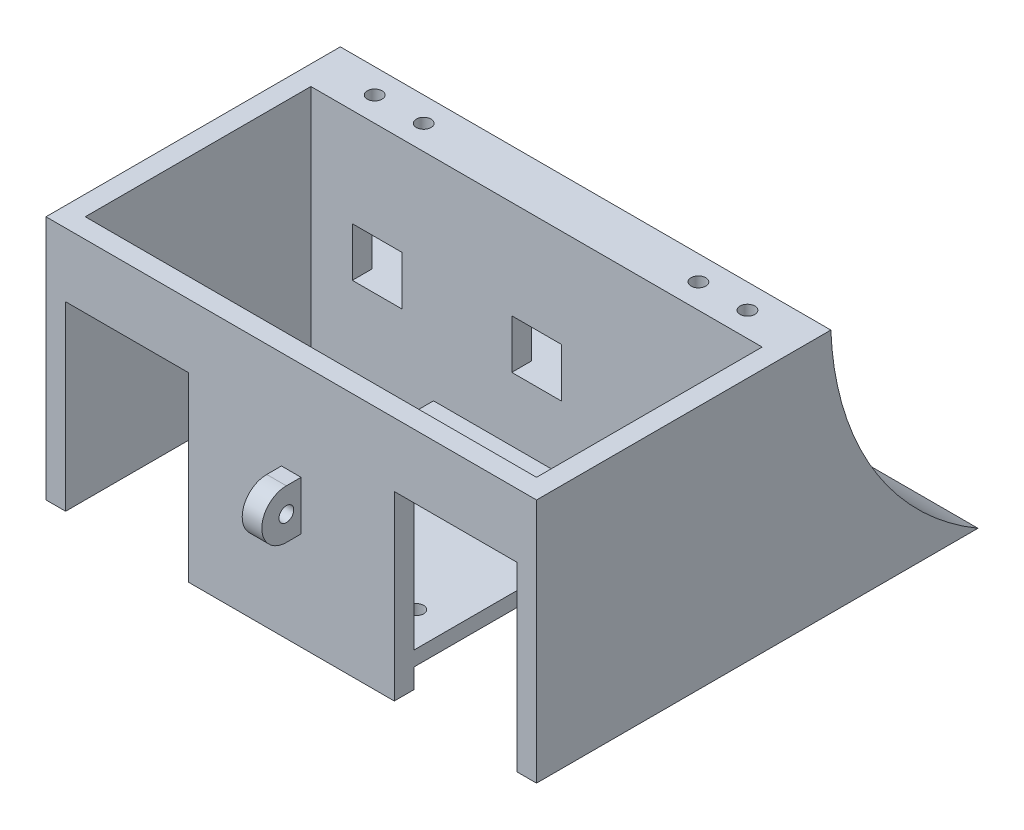
from build123d import *

# Parameters (mm, degrees)
CROQUIS1_W                          = 100
CROQUIS1_H                          = 60
SALIENTE_EXTRUIR1_DEPTH             = 50
VACIADO1_T                          = -4
SALIENTE_EXTRUIR2_REACH             = 78.811
SALIENTE_EXTRUIR2_DIRECTION_2_REACH = 78.811
CORTAR_EXTRUIR1_START               = -4
CROQUIS3_W                          = 44
CROQUIS3_H                          = 37
CORTAR_EXTRUIR1_DEPTH               = 25
CROQUIS5_W                          = 92
CROQUIS5_H                          = 46
SALIENTE_EXTRUIR3_DEPTH             = 6
CORTAR_EXTRUIR2_START               = 2
CROQUIS4_W                          = 10.1
CROQUIS4_H                          = 10
CORTAR_EXTRUIR2_DEPTH               = 16
CROQUIS4_3_W                        = 10.1
CROQUIS4_3_H                        = 10
CORTAR_EXTRUIR3_DEPTH               = 6
SALIENTE_EXTRUIR4_DEPTH             = 3
CORTAR_EXTRUIR4_DEPTH               = 4
CROQUIS7_R                          = 1.5
CROQUIS7_W                          = 25
CROQUIS7_H                          = 6
CORTAR_EXTRUIR5_DEPTH               = 3
CORTAR_EXTRUIR6_START               = -2
CORTAR_EXTRUIR6_DEPTH               = 2
CROQUIS9_R                          = 1.5
CORTAR_EXTRUIR7_DEPTH               = 5
MATRIZL2_COUNT                      = 2
MATRIZL2_PITCH                      = 32.5
MATRIZL2_COL_COUNT                  = 2
MATRIZL2_COL_PITCH                  = 32.5
SALIENTE_EXTRUIR5_DEPTH             = 2
SALIENTE_EXTRUIR5_DEPTH_BACK        = 2
CROQUIS10_R                         = 1.5


# Read off the part's stored shape, not the designer's step: Cortar-Extruir6
with BuildPart() as part:
    # Croquis1 → Saliente-Extruir1 (new body)
    with BuildSketch(Plane(origin=(0, 0, 0), x_dir=(1, 0, 0), z_dir=(0, 1, 0))):
        Rectangle(CROQUIS1_W, CROQUIS1_H)
    extrude(amount=SALIENTE_EXTRUIR1_DEPTH)

    # Vaciado1
    vaciado1_openings = [part.faces().sort_by_distance(p)[0] for p in [
        (0, 50, 0),
    ]]
    offset(amount=VACIADO1_T, openings=vaciado1_openings, kind=Kind.INTERSECTION)

    # Saliente-Extruir2: up to this face of the body (flat: up to its plane)
    saliente_extruir2_end = Plane(part.part.faces().sort_by_distance((50, 25, 0))[0])
    # Croquis2 → Saliente-Extruir2 (add, up to the picked face)
    with BuildSketch(Plane(origin=(0, 0, 0), x_dir=(0, 0, -1), z_dir=(1, 0, 0)), mode=Mode.PRIVATE) as saliente_extruir2_sk1:
        with BuildLine():
            Line((30, 50), (30, 0))
            Line((30, 0), (60, 0))
            ThreePointArc((60, 0), (38.605216469, 21.163129881), (30, 50))
        make_face()
    saliente_extruir2_tool1 = split(extrude(saliente_extruir2_sk1.sketch, amount=SALIENTE_EXTRUIR2_REACH, mode=Mode.PRIVATE), bisect_by=saliente_extruir2_end, keep=Keep.BOTH, mode=Mode.PRIVATE)
    add(saliente_extruir2_tool1.solids().sort_by(Axis((0, 12.297195, -38.437511), (1, 0, 0)))[0])

    # Saliente-Extruir2 direction 2: up to this face of the body (flat: up to its plane)
    saliente_extruir2_direction_2_end = Plane(part.part.faces().sort_by_distance((-50, 25, 0))[0])
    # Croquis2 → Saliente-Extruir2 direction 2 (add, up to the picked face)
    with BuildSketch(Plane(origin=(0, 0, 0), x_dir=(0, 0, -1), z_dir=(1, 0, 0)), mode=Mode.PRIVATE) as saliente_extruir2_direction_2_sk1:
        with BuildLine():
            Line((30, 50), (30, 0))
            Line((30, 0), (60, 0))
            ThreePointArc((60, 0), (38.605216469, 21.163129881), (30, 50))
        make_face()
    saliente_extruir2_direction_2_tool1 = split(extrude(saliente_extruir2_direction_2_sk1.sketch, amount=-SALIENTE_EXTRUIR2_DIRECTION_2_REACH, mode=Mode.PRIVATE), bisect_by=saliente_extruir2_direction_2_end, keep=Keep.BOTH, mode=Mode.PRIVATE)
    add(saliente_extruir2_direction_2_tool1.solids().sort_by(Axis((0, 12.297195, -38.437511), (-1, 0, 0)))[0])

    # Croquis3 → Cortar-Extruir1 (cut)
    with BuildSketch(Plane.ZY.offset(50).offset(CORTAR_EXTRUIR1_START)):
        with Locations((8, 18.5)):
            Rectangle(CROQUIS3_W, CROQUIS3_H)
    cortar_extruir1 = extrude(amount=-CORTAR_EXTRUIR1_DEPTH, mode=Mode.SUBTRACT)

    # Croquis5 → Saliente-Extruir3 (add)
    with BuildSketch(Plane.XY.offset(-26)):
        with Locations((0, 27)):
            Rectangle(CROQUIS5_W, CROQUIS5_H)
    extrude(amount=SALIENTE_EXTRUIR3_DEPTH)

    # Croquis4 → Cortar-Extruir2 (cut)
    with BuildSketch(Plane.XY.offset(-26).offset(CORTAR_EXTRUIR2_START)):
        with Locations((0, 25)):
            Rectangle(CROQUIS4_W, CROQUIS4_H)
        Polygon((15.25, 45), (-15.25, 45), (-15.25, 20), (-5.05, 20), (-5.05, 30), (5.05, 30), (5.05, 20), (15.25, 20), align=None)
    cortar_extruir2 = extrude(amount=-CORTAR_EXTRUIR2_DEPTH, mode=Mode.SUBTRACT)

    # Croquis4<3> → Cortar-Extruir3 (cut)
    with BuildSketch(Plane.XY.offset(-26)):
        with Locations((0, 25)):
            Rectangle(CROQUIS4_3_W, CROQUIS4_3_H)
    cortar_extruir3 = extrude(amount=CORTAR_EXTRUIR3_DEPTH, mode=Mode.SUBTRACT)

    # Croquis6 → Saliente-Extruir4 (add)
    with BuildSketch(Plane(origin=(0, 4, 0), x_dir=(1, 0, 0), z_dir=(0, 1, 0))):
        Polygon((46, 20), (-46, 20), (-46, 14), (-21, 14), (-21, -26), (46, -26), align=None)
    extrude(amount=SALIENTE_EXTRUIR4_DEPTH)

    # Croquis6<2> → Cortar-Extruir4 (cut)
    with BuildSketch(Plane(origin=(0, 4, 0), x_dir=(1, 0, 0), z_dir=(0, 1, 0))):
        Polygon((46, 20), (-46, 20), (-46, 14), (-21, 14), (-21, -26), (46, -26), align=None)
    extrude(amount=-CORTAR_EXTRUIR4_DEPTH, mode=Mode.SUBTRACT)

    # Croquis7 → Cortar-Extruir5 (cut)
    with BuildSketch(Plane(origin=(0, 7, 0), x_dir=(1, 0, 0), z_dir=(0, 1, 0))):
        with Locations(Location((-14.1, -18.6, 0), (0, 0, 270))):
            Circle(CROQUIS7_R)
        with Locations(Location((-14.1, 4.4, 0), (0, 0, 270))):
            Circle(CROQUIS7_R)
        with Locations((-33.5, 17)):
            Rectangle(CROQUIS7_W, CROQUIS7_H)
    cortar_extruir5 = extrude(amount=-CORTAR_EXTRUIR5_DEPTH, mode=Mode.SUBTRACT)

    # Cortar-Extruir6 outline → Cortar-Extruir6 (cut)
    # profile 1 of 7: a face of its own
    with BuildSketch(Plane.XZ.offset(CORTAR_EXTRUIR6_START)):
        with BuildLine():
            add(Edge.make_bspline(
                [(18.888271585, -42.352393977), (18.884484386, -42.423868512), (18.876982857, -42.565442321), (18.813577354, -42.76853097), (18.712467671, -42.954955074), (18.571846334, -43.120483121), (18.394972631, -43.265694686), (18.179407906, -43.375225333), (17.935081569, -43.448844865), (17.76258819, -43.457813268), (17.674797559, -43.462377743)],
                knots=[0, 0, 0, 0, 0.116932385, 0.231614839, 0.34522054, 0.462467825, 0.585400328, 0.717791731, 0.856369898, 1, 1, 1, 1], degree=3))
            add(Edge.make_bspline(
                [(17.674797559, -41.254585535), (17.763389132, -41.258694265), (17.935697765, -41.266685653), (18.177177697, -41.34503228), (18.392463639, -41.452351176), (18.571177721, -41.596634907), (18.717121011, -41.760131049), (18.814170619, -41.947213877), (18.876740836, -42.145501203), (18.884400246, -42.282931699), (18.888271585, -42.352393977)],
                knots=[0, 0, 0, 0, 0.145662332, 0.283309988, 0.415047197, 0.54050675, 0.659953064, 0.773758148, 0.885649294, 1, 1, 1, 1], degree=3))
            add(Edge.make_bspline(
                [(16.58307678, -42.364569301), (16.58652142, -42.28696319), (16.593261486, -42.135112676), (16.659638507, -41.918883094), (16.759439169, -41.72601533), (16.895115639, -41.562632424), (17.056479671, -41.427973634), (17.246142952, -41.331900385), (17.45395748, -41.26494248), (17.600539476, -41.258068086), (17.674797559, -41.254585535)],
                knots=[0, 0, 0, 0, 0.133733755, 0.26167449, 0.387130703, 0.506684142, 0.62623758, 0.747503629, 0.872085953, 1, 1, 1, 1], degree=3))
            add(Edge.make_bspline(
                [(17.674797559, -43.462377743), (17.599321746, -43.458606869), (17.451193809, -43.451206198), (17.239787685, -43.389378358), (17.054227298, -43.287246715), (16.890184198, -43.159675217), (16.758807001, -42.997357071), (16.658466944, -42.808565511), (16.593408285, -42.593932994), (16.58657107, -42.442143981), (16.58307678, -42.364569301)],
                knots=[0, 0, 0, 0, 0.130782073, 0.256671348, 0.377953313, 0.496525494, 0.614923347, 0.737239779, 0.865711362, 1, 1, 1, 1], degree=3))
        make_face()
    # profile 2 of 7: a face of its own
    with BuildSketch(Plane.XZ.offset(CORTAR_EXTRUIR6_START)):
        with BuildLine():
            add(Edge.make_bspline(
                [(9.961729377, -33.202637483), (10.078086415, -33.20396258), (10.306179155, -33.206560146), (10.641305435, -33.222314884), (10.962051584, -33.251193631), (11.269559714, -33.289071545), (11.563563058, -33.33939217), (11.843716201, -33.402618139), (12.109982733, -33.475309646), (12.36257057, -33.558790311), (12.602442614, -33.652057186), (12.830212297, -33.755455269), (13.045308722, -33.869305582), (13.248379923, -33.991384069), (13.440925399, -34.120089244), (13.616724077, -34.264275749), (13.783741804, -34.412883651), (13.986441364, -34.625165883), (14.214017896, -34.910386783), (14.44526318, -35.283963823), (14.630151513, -35.689662854), (14.772665977, -36.123167), (14.879795025, -36.58187545), (14.952457445, -37.063099713), (15.001942006, -37.566460721), (15.006217323, -37.909628466), (15.008401455, -38.084942678)],
                knots=[0, 0, 0, 0, 0.043180069, 0.084645162, 0.124459927, 0.162661114, 0.199594386, 0.235096819, 0.269197997, 0.301980353, 0.333770389, 0.364660784, 0.394752534, 0.424024931, 0.452569381, 0.48059819, 0.508323011, 0.535484198, 0.589424801, 0.643410939, 0.698108386, 0.754465297, 0.812487963, 0.872697628, 0.934964998, 1, 1, 1, 1], degree=3))
            Line((9.961729377, -33.202637483), (5.771388468, -33.202637483))
            Line((5.771388468, -33.202637483), (5.771388468, -33.981858262))
            Line((5.771388468, -33.981858262), (7.116761845, -33.981858262))
            Line((7.116761845, -33.981858262), (7.116761845, -42.423416704))
            Line((7.116761845, -42.423416704), (5.771388468, -42.423416704))
            Line((5.771388468, -42.423416704), (5.771388468, -43.202637483))
            Line((5.771388468, -43.202637483), (9.860268339, -43.202637483))
            add(Edge.make_bspline(
                [(15.008401455, -38.084942678), (15.004738902, -38.291405953), (14.997407606, -38.704681395), (14.941688972, -39.218452009), (14.875402695, -39.625366999), (14.808741523, -39.92495049), (14.724708647, -40.218768001), (14.626169232, -40.505712764), (14.51053056, -40.785736663), (14.374241877, -41.055312379), (14.219607314, -41.315622483), (14.047019061, -41.566374551), (13.852501182, -41.806201693), (13.62690437, -42.0271023), (13.376968106, -42.234899034), (13.098980862, -42.425828897), (12.794904929, -42.601762358), (12.459414016, -42.751394481), (12.099579316, -42.889914253), (11.70885419, -43.001415556), (11.289882939, -43.094852833), (10.839633371, -43.153985425), (10.360310068, -43.197604147), (10.030157565, -43.200927406), (9.860268339, -43.202637483)],
                knots=[0, 0, 0, 0, 0.074322882, 0.148771358, 0.185807886, 0.222738558, 0.25920372, 0.295789058, 0.331928241, 0.368198494, 0.404454025, 0.440867911, 0.477727844, 0.515443619, 0.554360706, 0.594625465, 0.636736502, 0.680657414, 0.726750954, 0.775461095, 0.826815655, 0.881167312, 0.938851309, 1, 1, 1, 1], degree=3))
        make_face()
        with BuildLine():
            add(Edge.make_bspline(
                [(13.159781326, -38.099147223), (13.158632612, -37.983481359), (13.156381956, -37.756859088), (13.149635749, -37.424590376), (13.13240756, -37.10666968), (13.111310337, -36.803388039), (13.080698489, -36.515776375), (13.043579106, -36.244514677), (12.992432815, -35.990643527), (12.931685925, -35.752860866), (12.862116119, -35.531008526), (12.777204563, -35.327104304), (12.68554965, -35.136670312), (12.576272511, -34.963955156), (12.457389878, -34.803322315), (12.318766809, -34.660812858), (12.167259448, -34.529720799), (11.996238881, -34.416626125), (11.810081477, -34.312825201), (11.601716837, -34.227092534), (11.373790391, -34.152133468), (11.125100472, -34.08902294), (10.854490136, -34.04079603), (10.561657054, -34.00775423), (10.246213269, -33.983813067), (10.028067166, -33.982525357), (9.9150573, -33.981858262)],
                knots=[0, 0, 0, 0, 0.056108201, 0.109931898, 0.161182084, 0.210528593, 0.257377396, 0.301457147, 0.343281306, 0.382910323, 0.42047119, 0.455931338, 0.489972749, 0.522838048, 0.554926075, 0.586717515, 0.619066154, 0.65191671, 0.685983409, 0.722301395, 0.761001391, 0.802301068, 0.846642567, 0.894216443, 0.945199179, 1, 1, 1, 1], degree=3))
            add(Edge.make_bspline(
                [(9.773011845, -42.423416704), (9.934758077, -42.421383786), (10.243819718, -42.417499326), (10.684926964, -42.380177837), (11.081683396, -42.324191183), (11.435541481, -42.240266101), (11.749786376, -42.123775868), (12.02857349, -41.974698801), (12.269879393, -41.785964231), (12.479838904, -41.562716937), (12.655318795, -41.295723843), (12.800559432, -40.985532476), (12.919944821, -40.632283672), (12.992811461, -40.307447484), (13.039660285, -40.024661374), (13.071938869, -39.793228818), (13.1008174, -39.547056154), (13.122770551, -39.285814874), (13.138407109, -39.009702532), (13.150412184, -38.719490026), (13.159259354, -38.414406806), (13.159604367, -38.206026271), (13.159781326, -38.099147223)],
                knots=[0, 0, 0, 0, 0.074436008, 0.142230916, 0.203611821, 0.258737414, 0.30928069, 0.357486624, 0.40363574, 0.449674445, 0.497945689, 0.550030491, 0.60694023, 0.669249064, 0.703031575, 0.738873314, 0.776797949, 0.817107808, 0.859524554, 0.904086725, 0.950805773, 1, 1, 1, 1], degree=3))
            Line((9.773011845, -42.423416704), (8.817248858, -42.423416704))
            Line((8.817248858, -42.423416704), (8.817248858, -33.981858262))
            Line((8.817248858, -33.981858262), (9.9150573, -33.981858262))
        make_face(mode=Mode.SUBTRACT)
    # profile 3 of 7: a face of its own
    with BuildSketch(Plane.XZ.offset(CORTAR_EXTRUIR6_START)):
        with BuildLine():
            add(Edge.make_bspline(
                [(4.6025573, -42.352393977), (4.5987701, -42.423868512), (4.591268571, -42.565442321), (4.527863068, -42.76853097), (4.426753385, -42.954955074), (4.286132049, -43.120483121), (4.109258346, -43.265694686), (3.89369362, -43.375225333), (3.649367283, -43.448844865), (3.476873904, -43.457813268), (3.389083274, -43.462377743)],
                knots=[0, 0, 0, 0, 0.116932385, 0.231614839, 0.34522054, 0.462467825, 0.585400328, 0.717791731, 0.856369898, 1, 1, 1, 1], degree=3))
            add(Edge.make_bspline(
                [(3.389083274, -41.254585535), (3.477674846, -41.258694265), (3.64998348, -41.266685653), (3.891463411, -41.34503228), (4.106749353, -41.452351176), (4.285463436, -41.596634907), (4.431406726, -41.760131049), (4.528456334, -41.947213877), (4.591026551, -42.145501203), (4.59868596, -42.282931699), (4.6025573, -42.352393977)],
                knots=[0, 0, 0, 0, 0.145662332, 0.283309988, 0.415047197, 0.54050675, 0.659953064, 0.773758148, 0.885649294, 1, 1, 1, 1], degree=3))
            add(Edge.make_bspline(
                [(2.297362494, -42.364569301), (2.300807134, -42.28696319), (2.3075472, -42.135112676), (2.373924222, -41.918883094), (2.473724883, -41.72601533), (2.609401354, -41.562632424), (2.770765386, -41.427973634), (2.960428666, -41.331900385), (3.168243194, -41.26494248), (3.314825191, -41.258068086), (3.389083274, -41.254585535)],
                knots=[0, 0, 0, 0, 0.133733755, 0.26167449, 0.387130703, 0.506684142, 0.62623758, 0.747503629, 0.872085953, 1, 1, 1, 1], degree=3))
            add(Edge.make_bspline(
                [(3.389083274, -43.462377743), (3.31360746, -43.458606869), (3.165479523, -43.451206198), (2.954073399, -43.389378358), (2.768513012, -43.287246715), (2.604469912, -43.159675217), (2.473092715, -42.997357071), (2.372752659, -42.808565511), (2.307693999, -42.593932994), (2.300856784, -42.442143981), (2.297362494, -42.364569301)],
                knots=[0, 0, 0, 0, 0.130782073, 0.256671348, 0.377953313, 0.496525494, 0.614923347, 0.737239779, 0.865711362, 1, 1, 1, 1], degree=3))
        make_face()
    # profile 4 of 7: a face of its own
    with BuildSketch(Plane.XZ.offset(CORTAR_EXTRUIR6_START)):
        with BuildLine():
            add(Edge.make_bspline(
                [(-3.93843296, -37.618221899), (-3.866724146, -37.617956306), (-3.730718823, -37.617452575), (-3.538649118, -37.610474934), (-3.368606751, -37.603920455), (-3.219564747, -37.58973592), (-3.087319514, -37.569939739), (-2.972740665, -37.531903837), (-2.870914516, -37.48616399), (-2.782415559, -37.423675609), (-2.707169746, -37.339970181), (-2.640560877, -37.236934022), (-2.586763342, -37.109184649), (-2.536583513, -36.956836816), (-2.494399188, -36.767296058), (-2.45907824, -36.532699185), (-2.429754946, -36.248203247), (-2.414574041, -36.041564366), (-2.406371272, -35.92991021)],
                knots=[0, 0, 0, 0, 0.077918038, 0.147781943, 0.208861328, 0.262765604, 0.310498151, 0.353734685, 0.393522182, 0.431460662, 0.470473383, 0.515123849, 0.564157341, 0.620640993, 0.689287881, 0.774847026, 0.878342037, 1, 1, 1, 1], degree=3))
            Line((-3.93843296, -37.618221899), (-4.559374519, -37.618221899))
            Line((-4.559374519, -37.618221899), (-4.559374519, -33.981858262))
            Line((-4.559374519, -33.981858262), (-2.68843296, -33.981858262))
            add(Edge.make_bspline(
                [(-0.36903361, -36.18965047), (-0.387720016, -36.066387923), (-0.422831537, -35.834779149), (-0.485798383, -35.512698009), (-0.549465718, -35.237328029), (-0.618077827, -35.004681033), (-0.69735547, -34.807676051), (-0.782525138, -34.634170654), (-0.887279014, -34.488204407), (-1.002541053, -34.362293406), (-1.136080659, -34.259130945), (-1.288023053, -34.172833804), (-1.461971895, -34.106401825), (-1.658008907, -34.059212051), (-1.877035529, -34.022353755), (-2.1226234, -34.000483018), (-2.395964112, -33.982543953), (-2.58761115, -33.982094638), (-2.68843296, -33.981858262)],
                knots=[0, 0, 0, 0, 0.100276022, 0.188417382, 0.263906678, 0.327592325, 0.383263949, 0.434608959, 0.482616625, 0.527272883, 0.57146264, 0.617759396, 0.667371346, 0.720685132, 0.77972221, 0.84588167, 0.918921319, 1, 1, 1, 1], degree=3))
            Line((-0.36903361, -36.18965047), (0.475122235, -36.18965047))
            Line((0.475122235, -36.18965047), (0.331047559, -33.202637483))
            Line((0.331047559, -33.202637483), (-7.605234908, -33.202637483))
            Line((-7.605234908, -33.202637483), (-7.605234908, -33.981858262))
            Line((-7.605234908, -33.981858262), (-6.259861532, -33.981858262))
            Line((-6.259861532, -33.981858262), (-6.259861532, -42.423416704))
            Line((-6.259861532, -42.423416704), (-7.605234908, -42.423416704))
            Line((-7.605234908, -42.423416704), (-7.605234908, -43.202637483))
            Line((-7.605234908, -43.202637483), (0.499472884, -43.202637483))
            Line((0.499472884, -43.202637483), (0.643547559, -39.566273847))
            Line((0.643547559, -39.566273847), (-0.200608285, -39.566273847))
            add(Edge.make_bspline(
                [(-3.037458934, -42.423416704), (-2.95222315, -42.423254394), (-2.788472159, -42.422942572), (-2.553037934, -42.414305081), (-2.337211579, -42.402219708), (-2.081856363, -42.382501774), (-1.794688199, -42.339357379), (-1.485289246, -42.254108032), (-1.220491867, -42.130934321), (-1.034926991, -41.992295598), (-0.909010628, -41.860943165), (-0.822336186, -41.746617676), (-0.741094244, -41.618226653), (-0.665393011, -41.474258435), (-0.595410692, -41.313843199), (-0.527531275, -41.137768625), (-0.469924642, -40.943172154), (-0.414281031, -40.729335796), (-0.361595237, -40.487420782), (-0.307025844, -40.212838439), (-0.252271604, -39.901609544), (-0.218438939, -39.682008859), (-0.200608285, -39.566273847)],
                knots=[0, 0, 0, 0, 0.05445262, 0.104611819, 0.150493048, 0.192553926, 0.268220917, 0.335654327, 0.396929789, 0.45371437, 0.482445036, 0.512956787, 0.545206301, 0.579422652, 0.616763016, 0.656973875, 0.699898362, 0.746331873, 0.798126817, 0.858046255, 0.925186852, 1, 1, 1, 1], degree=3))
            Line((-3.037458934, -42.423416704), (-4.559374519, -42.423416704))
            Line((-4.559374519, -42.423416704), (-4.559374519, -38.397442678))
            Line((-4.559374519, -38.397442678), (-3.93843296, -38.397442678))
            add(Edge.make_bspline(
                [(-2.408400493, -40.215624496), (-2.415235091, -40.101943361), (-2.427939171, -39.890634033), (-2.454259566, -39.59831022), (-2.482784406, -39.354223102), (-2.519522466, -39.154213795), (-2.562462387, -38.989898952), (-2.611932202, -38.851058474), (-2.674743506, -38.736996361), (-2.747550901, -38.642848259), (-2.83611049, -38.569976161), (-2.940298527, -38.512974523), (-3.060297395, -38.467708989), (-3.199064233, -38.441944569), (-3.354901007, -38.421474011), (-3.531097717, -38.408764798), (-3.727922551, -38.397215006), (-3.866035541, -38.397364378), (-3.93843296, -38.397442678)],
                knots=[0, 0, 0, 0, 0.118856032, 0.220928374, 0.306303417, 0.375257054, 0.432965082, 0.483450198, 0.528637455, 0.568328747, 0.606925072, 0.647381224, 0.691834584, 0.740155793, 0.794271569, 0.855888985, 0.924458477, 1, 1, 1, 1], degree=3))
            Line((-2.408400493, -40.215624496), (-1.548010882, -40.215624496))
            Line((-1.548010882, -40.215624496), (-1.548010882, -35.92991021))
            Line((-1.548010882, -35.92991021), (-2.406371272, -35.92991021))
        make_face()
    # profile 5 of 7: a face of its own
    with BuildSketch(Plane.XZ.offset(CORTAR_EXTRUIR6_START)):
        with BuildLine():
            add(Edge.make_bspline(
                [(-8.774066077, -42.352393977), (-8.777853277, -42.423868512), (-8.785354806, -42.565442321), (-8.848760308, -42.76853097), (-8.949869992, -42.954955074), (-9.090491328, -43.120483121), (-9.267365031, -43.265694686), (-9.482929757, -43.375225333), (-9.727256093, -43.448844865), (-9.899749473, -43.457813268), (-9.987540103, -43.462377743)],
                knots=[0, 0, 0, 0, 0.116932385, 0.231614839, 0.34522054, 0.462467825, 0.585400328, 0.717791731, 0.856369898, 1, 1, 1, 1], degree=3))
            add(Edge.make_bspline(
                [(-9.987540103, -41.254585535), (-9.898948531, -41.258694265), (-9.726639897, -41.266685653), (-9.485159966, -41.34503228), (-9.269874023, -41.452351176), (-9.091159941, -41.596634907), (-8.945216651, -41.760131049), (-8.848167043, -41.947213877), (-8.785596826, -42.145501203), (-8.777937416, -42.282931699), (-8.774066077, -42.352393977)],
                knots=[0, 0, 0, 0, 0.145662332, 0.283309988, 0.415047197, 0.54050675, 0.659953064, 0.773758148, 0.885649294, 1, 1, 1, 1], degree=3))
            add(Edge.make_bspline(
                [(-11.079260882, -42.364569301), (-11.075816243, -42.28696319), (-11.069076177, -42.135112676), (-11.002699155, -41.918883094), (-10.902898494, -41.72601533), (-10.767222023, -41.562632424), (-10.605857991, -41.427973634), (-10.41619471, -41.331900385), (-10.208380183, -41.26494248), (-10.061798186, -41.258068086), (-9.987540103, -41.254585535)],
                knots=[0, 0, 0, 0, 0.133733755, 0.26167449, 0.387130703, 0.506684142, 0.62623758, 0.747503629, 0.872085953, 1, 1, 1, 1], degree=3))
            add(Edge.make_bspline(
                [(-9.987540103, -43.462377743), (-10.063015916, -43.458606869), (-10.211143854, -43.451206198), (-10.422549978, -43.389378358), (-10.608110365, -43.287246715), (-10.772153464, -43.159675217), (-10.903530662, -42.997357071), (-11.003870718, -42.808565511), (-11.068929378, -42.593932994), (-11.075766593, -42.442143981), (-11.079260882, -42.364569301)],
                knots=[0, 0, 0, 0, 0.130782073, 0.256671348, 0.377953313, 0.496525494, 0.614923347, 0.737239779, 0.865711362, 1, 1, 1, 1], degree=3))
        make_face()
    # profile 6 of 7: a face of its own
    with BuildSketch(Plane.XZ.offset(CORTAR_EXTRUIR6_START)):
        with BuildLine():
            add(Edge.make_bspline(
                [(-16.531777116, -33.202637483), (-16.34569351, -33.205365552), (-15.987260158, -33.210620346), (-15.471365662, -33.250421692), (-14.998094614, -33.318870039), (-14.566614196, -33.413558413), (-14.174825373, -33.53277325), (-13.82223328, -33.675607647), (-13.504585334, -33.835303061), (-13.230031793, -34.024503929), (-12.990107746, -34.22747878), (-12.787035807, -34.447447571), (-12.622513517, -34.684321714), (-12.499173595, -34.937494378), (-12.404725467, -35.201056145), (-12.341953376, -35.475810305), (-12.298171524, -35.760085079), (-12.294566859, -35.953411669), (-12.292734908, -36.051663457)],
                knots=[0, 0, 0, 0, 0.096635634, 0.186139095, 0.268508575, 0.344789968, 0.415350008, 0.48090933, 0.542183756, 0.599572947, 0.653640576, 0.70510764, 0.754608169, 0.802838432, 0.850949572, 0.89968761, 0.949019575, 1, 1, 1, 1], degree=3))
            Line((-16.531777116, -33.202637483), (-20.332507635, -33.202637483))
            Line((-20.332507635, -33.202637483), (-20.332507635, -33.981858262))
            Line((-20.332507635, -33.981858262), (-18.987134259, -33.981858262))
            Line((-18.987134259, -33.981858262), (-18.987134259, -42.423416704))
            Line((-18.987134259, -42.423416704), (-20.332507635, -42.423416704))
            Line((-20.332507635, -42.423416704), (-20.332507635, -43.202637483))
            Line((-20.332507635, -43.202637483), (-15.876338804, -43.202637483))
            Line((-15.876338804, -43.202637483), (-15.876338804, -42.423416704))
            Line((-15.876338804, -42.423416704), (-17.286647246, -42.423416704))
            Line((-17.286647246, -42.423416704), (-17.286647246, -39.176663457))
            Line((-17.286647246, -39.176663457), (-16.61903361, -39.176663457))
            add(Edge.make_bspline(
                [(-12.292734908, -36.051663457), (-12.295046803, -36.145134547), (-12.299687975, -36.332779526), (-12.338453145, -36.612875221), (-12.396226007, -36.892360545), (-12.481649658, -37.168731471), (-12.595153691, -37.440493644), (-12.75354923, -37.699329697), (-12.948630913, -37.946293807), (-13.182110837, -38.181131338), (-13.454840445, -38.400645118), (-13.775152683, -38.590949704), (-14.133977323, -38.765468081), (-14.464249797, -38.884405226), (-14.748334716, -38.970866485), (-14.979004032, -39.024947215), (-15.221435872, -39.071147742), (-15.476601519, -39.109964671), (-15.744010187, -39.139842649), (-16.024803409, -39.162710171), (-16.317932618, -39.174246293), (-16.517564246, -39.175848886), (-16.61903361, -39.176663457)],
                knots=[0, 0, 0, 0, 0.046474032, 0.093297498, 0.140412582, 0.188302147, 0.236986429, 0.286493836, 0.338724998, 0.393206089, 0.450900237, 0.512352899, 0.578112404, 0.649113025, 0.686688686, 0.725777805, 0.766886769, 0.809426141, 0.854123434, 0.90070087, 0.94952794, 1, 1, 1, 1], degree=3))
        make_face()
        with BuildLine():
            add(Edge.make_bspline(
                [(-14.114975168, -36.078043327), (-14.116028961, -35.988046745), (-14.118051772, -35.815293631), (-14.136573057, -35.565977116), (-14.166197023, -35.33747968), (-14.208007628, -35.127941067), (-14.266007704, -34.937151691), (-14.345203437, -34.764174417), (-14.447931347, -34.61070104), (-14.571827358, -34.473973496), (-14.720760592, -34.35439945), (-14.897727367, -34.253178617), (-15.10300464, -34.167889294), (-15.338796014, -34.100146642), (-15.606018778, -34.04543641), (-15.909241452, -34.007819081), (-16.248730433, -33.986586436), (-16.487779093, -33.983483154), (-16.612945947, -33.981858262)],
                knots=[0, 0, 0, 0, 0.070034476, 0.134434815, 0.194444482, 0.249267706, 0.300551824, 0.349306637, 0.396759397, 0.443716055, 0.492388375, 0.54475802, 0.601856862, 0.664988103, 0.735401446, 0.81395415, 0.902585634, 1, 1, 1, 1], degree=3))
            add(Edge.make_bspline(
                [(-16.720494648, -38.397442678), (-16.59872648, -38.395601591), (-16.366510419, -38.392090574), (-16.033694493, -38.373526799), (-15.733901788, -38.335992082), (-15.463504803, -38.290462777), (-15.22368713, -38.221597378), (-15.008899203, -38.141862447), (-14.824195156, -38.035535708), (-14.661689895, -37.915109729), (-14.523955798, -37.770942681), (-14.409983726, -37.603347303), (-14.313408102, -37.414905424), (-14.239031326, -37.20093052), (-14.182789403, -36.960754018), (-14.143427585, -36.692627203), (-14.11903092, -36.395052948), (-14.116369084, -36.186995962), (-14.114975168, -36.078043327)],
                knots=[0, 0, 0, 0, 0.088580303, 0.168925666, 0.242276937, 0.308284501, 0.368093327, 0.42355103, 0.474445387, 0.522562541, 0.570234953, 0.618682986, 0.669510715, 0.723819516, 0.783007934, 0.848692001, 0.920764953, 1, 1, 1, 1], degree=3))
            Line((-16.720494648, -38.397442678), (-17.286647246, -38.397442678))
            Line((-17.286647246, -38.397442678), (-17.286647246, -33.981858262))
            Line((-17.286647246, -33.981858262), (-16.612945947, -33.981858262))
        make_face(mode=Mode.SUBTRACT)
    # profile 7 of 7: a face of its own
    with BuildSketch(Plane.XZ.offset(CORTAR_EXTRUIR6_START)):
        Polygon((23.01570665, -42.423416704), (21.670333274, -42.423416704), (22.689002105, -39.826014106), (25.558320287, -39.826014106), (26.53031704, -42.423416704), (25.132183923, -42.423416704), (25.132183923, -43.202637483), (29.65531704, -43.202637483), (29.65531704, -42.423416704), (28.279505352, -42.423416704), (24.998255352, -33.202637483), (24.164245611, -33.202637483), (20.669927429, -42.423416704), (19.352963144, -42.423416704), (19.352963144, -43.202637483), (23.01570665, -43.202637483), align=None)
        Polygon((24.196064566, -35.861865271), (25.335106001, -39.046793327), (22.948742365, -39.046793327), align=None, mode=Mode.SUBTRACT)
    extrude(amount=CORTAR_EXTRUIR6_DEPTH, mode=Mode.SUBTRACT)

    # Croquis9 → Cortar-Extruir7 (cut)
    with BuildSketch(Plane(origin=(0, 50, 0), x_dir=(1, 0, 0), z_dir=(0, 1, 0))):
        with Locations(Location((-38, 25, 0), (0, 0, 270))):
            Circle(CROQUIS9_R)
        with Locations(Location((-28, 25, 0), (0, 0, 270))):
            Circle(CROQUIS9_R)
    cortar_extruir7 = extrude(amount=-CORTAR_EXTRUIR7_DEPTH, mode=Mode.SUBTRACT)

    # Simetría1: Cortar-Extruir5, Cortar-Extruir7 across plane
    add(cortar_extruir5.mirror(Plane(origin=(0, 0, 0), x_dir=(0, 0, 1), z_dir=(1, 0, 0))), mode=Mode.SUBTRACT)
    add(cortar_extruir7.mirror(Plane(origin=(0, 0, 0), x_dir=(0, 0, 1), z_dir=(1, 0, 0))), mode=Mode.SUBTRACT)

    # Simetría2: Cortar-Extruir1 across plane
    add(cortar_extruir1.mirror(Plane(origin=(0, 0, 0), x_dir=(0, 0, 1), z_dir=(1, 0, 0))), mode=Mode.SUBTRACT)

    # MatrizL2: Cortar-Extruir2, Cortar-Extruir3 ×2
    with Locations(*[(i * MATRIZL2_PITCH, 0, 0) for i in range(1, MATRIZL2_COUNT)]):
        add(cortar_extruir2, mode=Mode.SUBTRACT)
        add(cortar_extruir3, mode=Mode.SUBTRACT)

    # MatrizL2 col: Cortar-Extruir2, Cortar-Extruir3 ×2
    with Locations(*[(-i * MATRIZL2_COL_PITCH, 0, 0) for i in range(1, MATRIZL2_COL_COUNT)]):
        add(cortar_extruir2, mode=Mode.SUBTRACT)
        add(cortar_extruir3, mode=Mode.SUBTRACT)

    # Croquis10 → Saliente-Extruir5 (add, two sides: drawn at the far end of the back side and taken through both)
    with BuildSketch(Plane(origin=(0, 0, 0), x_dir=(0, 0, -1), z_dir=(1, 0, 0)).offset(-SALIENTE_EXTRUIR5_DEPTH_BACK)):
        with BuildLine():
            Line((-30, 30), (-30, 20))
            Line((-30, 20), (-33, 20))
            ThreePointArc((-33, 20), (-38, 25), (-33, 30))
            Line((-33, 30), (-30, 30))
        make_face()
        with Locations((-33, 25)):
            Circle(CROQUIS10_R, mode=Mode.SUBTRACT)
    extrude(amount=SALIENTE_EXTRUIR5_DEPTH + SALIENTE_EXTRUIR5_DEPTH_BACK)


solid = part.part
